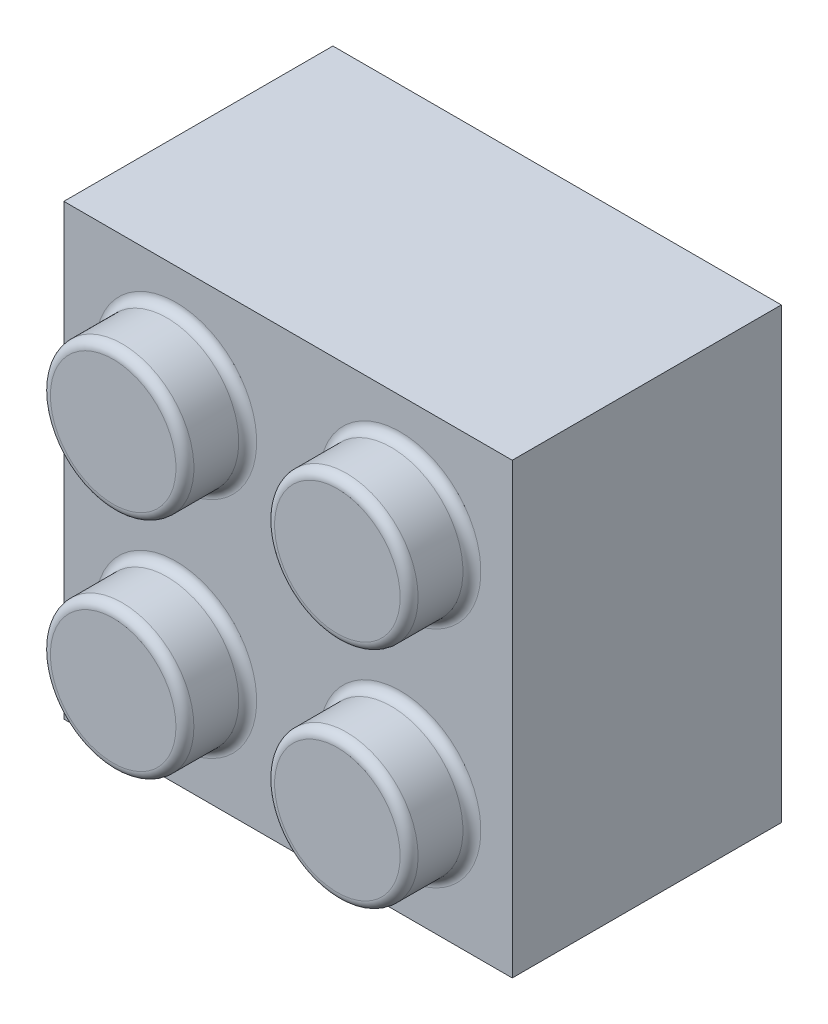
from build123d import *

# Parameters (mm, degrees)
ESQUISSE2_W             = 100
ESQUISSE2_H             = 100
BOSS_EXTRU_1_DEPTH      = 60
ESQUISSE3_R             = 16
BOSS_EXTRU_2_DEPTH      = 14
ESQUISSE4_W             = 84
ESQUISSE4_H             = 84
ESQUISSE4_R             = 18.5
ESQUISSE4_R_2           = 12
ENL_V_MAT_EXTRU_1_DEPTH = 50
CONG_9_R                = 2


with BuildPart() as part:
    # Esquisse2 → Boss.-Extru.1 (new body)
    with BuildSketch(Plane.XY):
        Rectangle(ESQUISSE2_W, ESQUISSE2_H)
    extrude(amount=BOSS_EXTRU_1_DEPTH)

    # Esquisse3 → Boss.-Extru.2 (add)
    with BuildSketch(Plane.XY.offset(60)):
        with Locations((25, 25)):
            Circle(ESQUISSE3_R)
        with Locations((25, -25)):
            Circle(ESQUISSE3_R)
        with Locations((-25, -25)):
            Circle(ESQUISSE3_R)
        with Locations((-25, 25)):
            Circle(ESQUISSE3_R)
    extrude(amount=BOSS_EXTRU_2_DEPTH)

    # Esquisse4 → Enlèv. mat.-Extru.1 (cut)
    # profile 1 of 2: a face of its own
    with BuildSketch(Plane(origin=(0, 0, 0), x_dir=(-1, 0, 0), z_dir=(0, 0, -1))):
        Rectangle(ESQUISSE4_W, ESQUISSE4_H)
        Circle(ESQUISSE4_R, mode=Mode.SUBTRACT)
    # profile 2 of 2: a face of its own
    with BuildSketch(Plane(origin=(0, 0, 0), x_dir=(-1, 0, 0), z_dir=(0, 0, -1))):
        Circle(ESQUISSE4_R_2)
    extrude(amount=-ENL_V_MAT_EXTRU_1_DEPTH, mode=Mode.SUBTRACT)

    # Congé9
    cong_9_edges = [part.edges().sort_by_distance(p)[0] for p in [
        (18.5, 0, 50),
        (18.5, 0, 0),
        (9, -25, 60),
        (9, -25, 74),
        (-41, -25, 60),
        (-41, -25, 74),
        (9, 25, 60),
        (9, 25, 74),
        (-41, 25, 60),
        (-41, 25, 74),
    ]]
    fillet(cong_9_edges, radius=CONG_9_R)


solid = part.part
